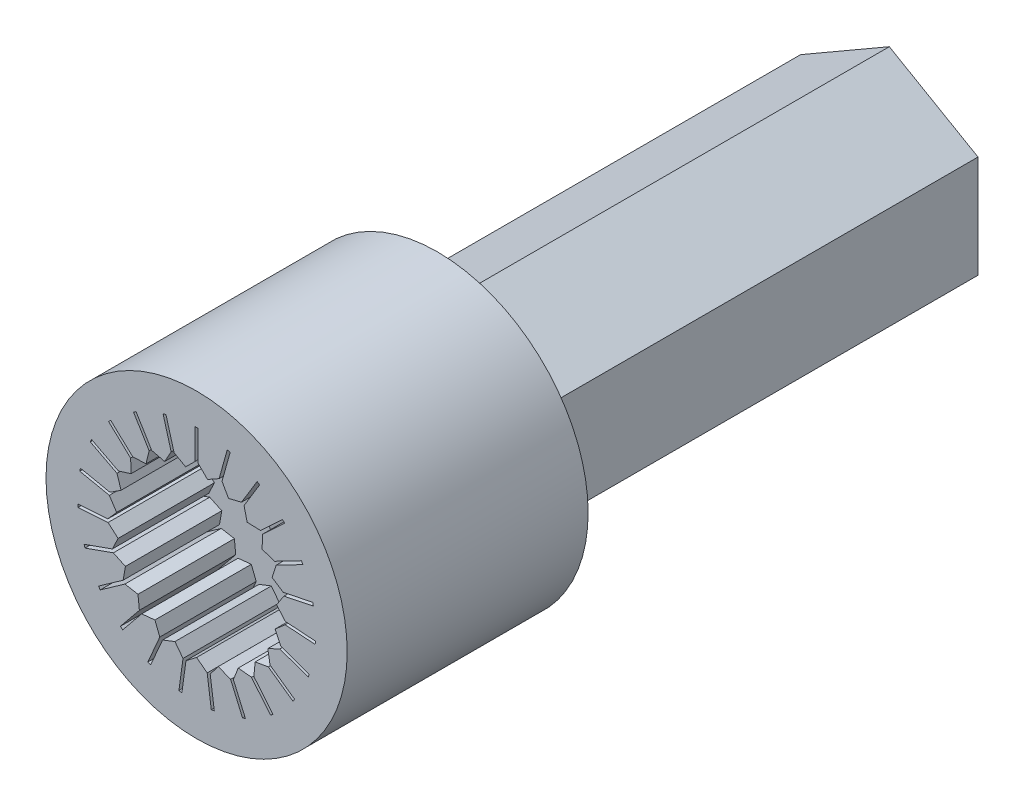
from build123d import *

# Parameters (mm, degrees)
EXTRUDE_1_DEPTH     = 15
SKETCH_6_R          = 5
EXTRUDE_3_DEPTH     = 8
CUT_EXTRUDE_5_DEPTH = 3.2
CHAMFER_1_SIZE      = 1
CUT_EXTRUDE_6_DEPTH = 25.062418831


with BuildPart() as part:
    # ｽｹｯﾁ1 → ﾎﾞｽ - 押し出し1 (new body)
    with BuildSketch(Plane.XY):
        Polygon((0, 3.4), (-2.944486373, 1.7), (-2.944486373, -1.7), (0, -3.4), (2.944486373, -1.7), (2.944486373, 1.7), align=None)
    extrude(amount=EXTRUDE_1_DEPTH)

    # ｽｹｯﾁ6 → ﾎﾞｽ - 押し出し3 (add)
    with BuildSketch(Plane.XY.offset(15)):
        Circle(SKETCH_6_R)
    extrude(amount=EXTRUDE_3_DEPTH)

    # ｽｹｯﾁ5 → ｶｯﾄ - 押し出し5 (cut)
    with BuildSketch(Plane.XY.offset(23)):
        Polygon((-0.05, 2.95), (-0.05, 3.95), (0.05, 3.95), (0.05, 2.95), (0.362514094, 2.637485906), (0.747754611, 2.854095836), (1.017551382, 3.817013124), (1.11384311, 3.790033446), (0.844046339, 2.827116159), (1.060656269, 2.441875642), (1.490051682, 2.546516441), (2.009635632, 3.400935845), (2.095077573, 3.34897745), (1.575493623, 2.494558046), (1.680134421, 2.065162633), (2.121838437, 2.050073571), (2.852674402, 2.732626714), (2.920929716, 2.659543117), (2.190093752, 1.976989974), (2.17500469, 1.535285958), (2.596258142, 1.401586122), (3.484143361, 1.86165116), (3.530149865, 1.772862638), (2.642264646, 1.3127976), (2.50856481, 0.891544148), (2.878125258, 0.649149443), (3.857209346, 0.852605456), (3.877554947, 0.754697047), (2.898470859, 0.551241034), (2.656076155, 0.181680586), (2.94653499, -0.151431681), (3.944203759, -0.219674094), (3.937379518, -0.319440971), (2.939710748, -0.251198558), (2.606598481, -0.541657393), (2.796413701, -0.94078181), (3.738674623, -1.275661422), (3.705186662, -1.369887514), (2.76292574, -1.035007902), (2.363801323, -1.224823122), (2.4388952, -1.660358456), (3.255865093, -2.237038778), (3.198197061, -2.318735767), (2.381227168, -1.742055445), (1.945691834, -1.817149322), (1.900495, -2.25679391), (2.531582945, -3.032505201), (2.454011816, -3.095613995), (1.822923871, -2.319902705), (1.383279283, -2.274705871), (1.22114378, -2.685853285), (1.61954487, -3.603064586), (1.52782374, -3.642904695), (1.12942265, -2.725693394), (0.718275236, -2.563557891), (0.451225912, -2.915715208), (0.587392561, -3.906401154), (0.488323967, -3.920017819), (0.352157318, -2.929331873), (0, -2.66228255), (-0.352157318, -2.929331873), (-0.488323967, -3.920017819), (-0.587392561, -3.906401154), (-0.451225912, -2.915715208), (-0.718275236, -2.563557891), (-1.12942265, -2.725693394), (-1.52782374, -3.642904695), (-1.61954487, -3.603064586), (-1.22114378, -2.685853285), (-1.383279283, -2.274705871), (-1.822923871, -2.319902705), (-2.454011816, -3.095613995), (-2.531582945, -3.032505201), (-1.900495, -2.25679391), (-1.945691834, -1.817149322), (-2.381227168, -1.742055445), (-3.198197061, -2.318735767), (-3.255865093, -2.237038778), (-2.4388952, -1.660358456), (-2.363801323, -1.224823122), (-2.76292574, -1.035007902), (-3.705186662, -1.369887514), (-3.738674623, -1.275661422), (-2.796413701, -0.94078181), (-2.606598481, -0.541657393), (-2.939710748, -0.251198558), (-3.937379518, -0.319440971), (-3.944203759, -0.219674094), (-2.94653499, -0.151431681), (-2.656076155, 0.181680586), (-2.898470859, 0.551241034), (-3.877554947, 0.754697047), (-3.857209346, 0.852605456), (-2.878125258, 0.649149443), (-2.50856481, 0.891544148), (-2.642264646, 1.3127976), (-3.530149865, 1.772862638), (-3.484143361, 1.86165116), (-2.596258142, 1.401586122), (-2.17500469, 1.535285958), (-2.190093752, 1.976989974), (-2.920929716, 2.659543117), (-2.852674402, 2.732626714), (-2.121838437, 2.050073571), (-1.680134421, 2.065162633), (-1.575493623, 2.494558046), (-2.095077573, 3.34897745), (-2.009635632, 3.400935845), (-1.490051682, 2.546516441), (-1.060656269, 2.441875642), (-0.844046339, 2.827116159), (-1.11384311, 3.790033446), (-1.017551382, 3.817013124), (-0.747754611, 2.854095836), (-0.362514094, 2.637485906), align=None)
    extrude(amount=-CUT_EXTRUDE_5_DEPTH, mode=Mode.SUBTRACT)

    # 面取り1
    chamfer_1_edges = [part.edges().sort_by_distance(p)[0] for p in [
        (1.472243186, 2.55, 15),
        (2.944486373, 0, 15),
        (1.472243186, -2.55, 15),
        (-1.472243186, -2.55, 15),
        (-2.944486373, 0, 15),
        (-1.472243186, 2.55, 15),
    ]]
    chamfer(chamfer_1_edges, length=CHAMFER_1_SIZE)

    # ｽｹｯﾁ7 → ｶｯﾄ - 押し出し6 (cut, through all)
    with BuildSketch(Plane(origin=(0, 0, 0), x_dir=(-1, 0, 0), z_dir=(0, 0, -1))):
        Polygon((1.3, 0), (0.65, 1.125833025), (-0.65, 1.125833025), (-1.3, 0), (-0.65, -1.125833025), (0.65, -1.125833025), align=None)
    extrude(amount=-CUT_EXTRUDE_6_DEPTH, mode=Mode.SUBTRACT)


solid = part.part
